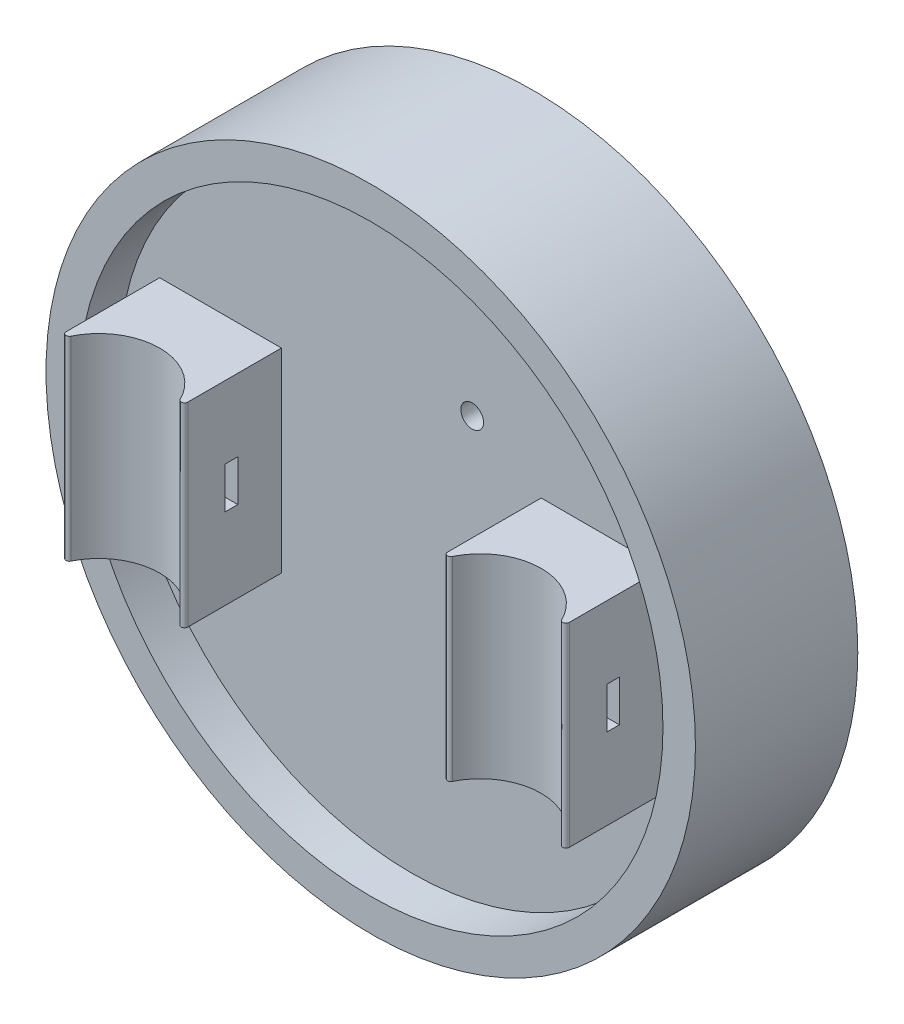
from build123d import *

# Parameters (mm, degrees)
SKETCH_1_R               = 40
EXTRUDE_4_DEPTH          = 15
SKETCH_1_8_W             = 15
SKETCH_1_8_H             = 24
EXTRUDE_5_DEPTH          = 15
EXTRUDE_START            = 5
SKETCH_1_9_R             = 40
SKETCH_1_9_R_2           = 36
EXTRUDE_6_DEPTH          = 5
CUT_EXTRUDE_1_DEPTH      = 68.297845434
CUT_EXTRUDE_1_DEPTH_BACK = 68.297845434
SKETCH_2_R               = 7.5
FILLET_START             = -13
FILLET_1_DEPTH           = 26
CUT_EXTRUDE_2_DEPTH      = 83.861329943
CUT_EXTRUDE_2_DEPTH_BACK = 83.861329943
SKETCH_3_W               = 1.548025895
SKETCH_3_H               = 5.100179719
SKETCH_4_R               = 1.5
CUT_EXTRUDE_3_DEPTH      = 5
EXTRUDE_8_DEPTH          = 5
SKETCH_5_4_R             = 1.4
CUT_EXTRUDE_4_DEPTH      = 5


with BuildPart() as part:
    # 스케치1 → 보스-돌출4 (new body)
    with BuildSketch(Plane.XY):
        Circle(SKETCH_1_R)
    extrude(amount=-EXTRUDE_4_DEPTH)

    # 스케치1<8> → 보스-돌출5 (add)
    with BuildSketch(Plane.XY):
        with Locations((-23.5, 0)):
            Rectangle(SKETCH_1_8_W, SKETCH_1_8_H)
        with Locations((23.5, 0)):
            Rectangle(SKETCH_1_8_W, SKETCH_1_8_H)
    extrude(amount=EXTRUDE_5_DEPTH)

    # 스케치1<9> → 보스-돌출6 (add)
    with BuildSketch(Plane.XY.offset(EXTRUDE_START)):
        Circle(SKETCH_1_9_R)
        Circle(SKETCH_1_9_R_2, mode=Mode.SUBTRACT)
    extrude(amount=-EXTRUDE_6_DEPTH)

    # 스케치2 → 컷-돌출1 (cut, two sides: drawn at the far end of the back side and taken through both)
    with BuildSketch(Plane.XZ.offset(12).offset(-CUT_EXTRUDE_1_DEPTH_BACK)):
        with Locations((-23.5, 15)):
            Circle(SKETCH_2_R)
        with Locations((23.5, 15)):
            Circle(SKETCH_2_R)
    extrude(amount=CUT_EXTRUDE_1_DEPTH + CUT_EXTRUDE_1_DEPTH_BACK, mode=Mode.SUBTRACT)

    # 필렛1: read off the stored shape, not the designer's step
    # 필렛1 outline → 필렛1 (cut)
    with BuildSketch(Plane(origin=(0, 0, 0), x_dir=(1, 0, 0), z_dir=(0, 1, 0)).offset(FILLET_START)):
        with BuildLine():
            Line((31, -15), (31, -11.535898385))
            ThreePointArc((31, -11.535898385), (30.690007032, -11.925640266), (30.240506329, -11.711295935))
            ThreePointArc((30.240506329, -11.711295935), (30.807660278, -13.312368149), (31, -15))
        make_face()
        with BuildLine():
            ThreePointArc((16, -15), (16.192339722, -13.312368149), (16.759493671, -11.711295935))
            ThreePointArc((16.759493671, -11.711295935), (16.309992968, -11.925640266), (16, -11.535898385))
            Line((16, -11.535898385), (16, -15))
        make_face()
        with BuildLine():
            Line((-16, -15), (-16, -11.535898385))
            ThreePointArc((-16, -11.535898385), (-16.309992968, -11.925640266), (-16.759493671, -11.711295935))
            ThreePointArc((-16.759493671, -11.711295935), (-16.192339722, -13.312368149), (-16, -15))
        make_face()
        with BuildLine():
            ThreePointArc((-31, -15), (-30.807660278, -13.312368149), (-30.240506329, -11.711295935))
            ThreePointArc((-30.240506329, -11.711295935), (-30.690007032, -11.925640266), (-31, -11.535898385))
            Line((-31, -11.535898385), (-31, -15))
        make_face()
    extrude(amount=FILLET_1_DEPTH, mode=Mode.SUBTRACT)

    # 스케치3 → 컷-돌출2 (cut, two sides: drawn at the far end of the back side and taken through both)
    with BuildSketch(Plane(origin=(31, 0, 0), x_dir=(0, 0, -1), z_dir=(1, 0, 0)).offset(-CUT_EXTRUDE_2_DEPTH_BACK)):
        with Locations((-6.14855499, 0.540949065)):
            Rectangle(SKETCH_3_W, SKETCH_3_H)
    extrude(amount=CUT_EXTRUDE_2_DEPTH + CUT_EXTRUDE_2_DEPTH_BACK, mode=Mode.SUBTRACT)

    # 스케치4 → 컷-돌출3 (cut)
    with BuildSketch(Plane.XY):
        with Locations((7.5, 15)):
            Circle(SKETCH_4_R)
        with Locations((7.5, -15)):
            Circle(SKETCH_4_R)
    extrude(amount=-CUT_EXTRUDE_3_DEPTH, mode=Mode.SUBTRACT)

    # 스케치5 → 보스-돌출8 (add)
    with BuildSketch(Plane.XY):
        with BuildLine():
            Line((7.5, 15.1), (7.5, 15))
            Line((7.5, 15), (7.5, 13.5))
            ThreePointArc((7.5, 13.5), (8.560660172, 13.939339828), (9, 15))
            ThreePointArc((9, 15), (8.933057899, 15.443108405), (8.738206588, 15.846666667))
            ThreePointArc((8.738206588, 15.846666667), (8.222956891, 15.301111626), (7.5, 15.1))
        make_face()
        with BuildLine():
            Line((7.5, 13.5), (7.5, 15))
            Line((7.5, 15), (7.5, 15.1))
            ThreePointArc((7.5, 15.1), (6.777043109, 15.301111626), (6.261793412, 15.846666667))
            ThreePointArc((6.261793412, 15.846666667), (6.173350084, 14.3), (7.5, 13.5))
        make_face()
        with BuildLine():
            ThreePointArc((6.261793412, 15.846666667), (6.777043109, 15.301111626), (7.5, 15.1))
            Line((7.5, 15.1), (7.5, 16.5))
            ThreePointArc((7.5, 16.5), (6.8, 16.326649916), (6.261793412, 15.846666667))
        make_face()
        with BuildLine():
            Line((7.5, 16.5), (7.5, 15.1))
            ThreePointArc((7.5, 15.1), (8.222956891, 15.301111626), (8.738206588, 15.846666667))
            ThreePointArc((8.738206588, 15.846666667), (8.2, 16.326649916), (7.5, 16.5))
        make_face()
        with BuildLine():
            ThreePointArc((9, -15), (8.560660172, -13.939339828), (7.5, -13.5))
            Line((7.5, -13.5), (7.5, -15))
            Line((7.5, -15), (7.5, -15.1))
            ThreePointArc((7.5, -15.1), (8.222956891, -15.301111626), (8.738206588, -15.846666667))
            ThreePointArc((8.738206588, -15.846666667), (8.933057899, -15.443108405), (9, -15))
        make_face()
        with BuildLine():
            Line((7.5, -15), (7.5, -13.5))
            ThreePointArc((7.5, -13.5), (6.173350084, -14.3), (6.261793412, -15.846666667))
            ThreePointArc((6.261793412, -15.846666667), (6.777043109, -15.301111626), (7.5, -15.1))
            Line((7.5, -15.1), (7.5, -15))
        make_face()
        with BuildLine():
            ThreePointArc((7.5, -15.1), (6.777043109, -15.301111626), (6.261793412, -15.846666667))
            ThreePointArc((6.261793412, -15.846666667), (6.8, -16.326649916), (7.5, -16.5))
            Line((7.5, -16.5), (7.5, -15.1))
        make_face()
        with BuildLine():
            ThreePointArc((8.738206588, -15.846666667), (8.222956891, -15.301111626), (7.5, -15.1))
            Line((7.5, -15.1), (7.5, -16.5))
            ThreePointArc((7.5, -16.5), (8.2, -16.326649916), (8.738206588, -15.846666667))
        make_face()
    extrude(amount=-EXTRUDE_8_DEPTH)

    # 스케치5<4> → 컷-돌출4 (cut)
    with BuildSketch(Plane.XY):
        with Locations((7.5, 16.5)):
            Circle(SKETCH_5_4_R)
        with Locations((7.5, -16.5)):
            Circle(SKETCH_5_4_R)
    extrude(amount=-CUT_EXTRUDE_4_DEPTH, mode=Mode.SUBTRACT)


solid = part.part
